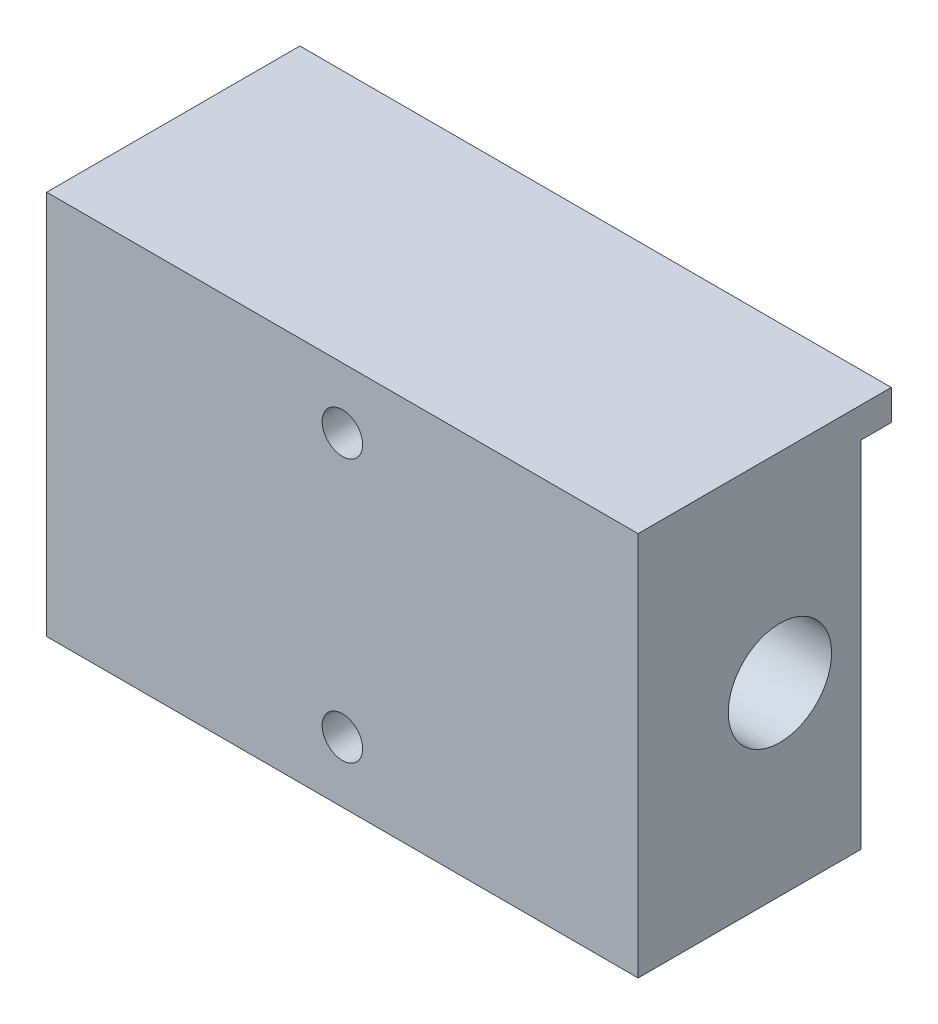
from build123d import *

# Parameters (mm, degrees)
CROQUIS1_W                                     = 58.4
CROQUIS1_H                                     = 38
SALIENTE_EXTRUIR1_DEPTH                        = 22
CROQUIS2_R                                     = 5.1
CORTAR_EXTRUIR1_DEPTH                          = 74.065450112
TALADROS_DE_ESPIGA_DE_4_0MM2_D                 = 4
TALADROS_DE_ESPIGA_DE_4_0MM2_DEPTH             = 14
TALADROS_DE_ESPIGA_DE_4_0MM2_TIP               = 1.201721238
CROQUIS6_W                                     = 58.4
CROQUIS6_H                                     = 3
SALIENTE_EXTRUIR2_DEPTH                        = 3
PERFORADOR_PARA_ROSCAR_PARA_MACHO_DE_ROS_D     = 2.5
PERFORADOR_PARA_ROSCAR_PARA_MACHO_DE_ROS_DEPTH = 14
PERFORADOR_PARA_ROSCAR_PARA_MACHO_DE_ROS_TIP   = 0.751075774


with BuildPart() as part:
    # Croquis1 → Saliente-Extruir1 (new body)
    with BuildSketch(Plane.XY):
        with Locations((29.2, 19)):
            Rectangle(CROQUIS1_W, CROQUIS1_H)
    extrude(amount=SALIENTE_EXTRUIR1_DEPTH)

    # Croquis2 → Cortar-Extruir1 (cut, through all)
    with BuildSketch(Plane(origin=(58.4, 0, 0), x_dir=(0, 0, -1), z_dir=(1, 0, 0))):
        with Locations((-8, 18.236268226)):
            Circle(CROQUIS2_R)
    extrude(amount=-CORTAR_EXTRUIR1_DEPTH, mode=Mode.SUBTRACT)

    # Taladros de espiga de Ø4.0mm2
    with Locations(Plane.XY.offset(22)):
        with Locations((29.2, 6), (29.2, 32)):
            Hole(TALADROS_DE_ESPIGA_DE_4_0MM2_D / 2, depth=TALADROS_DE_ESPIGA_DE_4_0MM2_DEPTH)
            with Locations((0, 0, -(TALADROS_DE_ESPIGA_DE_4_0MM2_DEPTH + TALADROS_DE_ESPIGA_DE_4_0MM2_TIP / 2))):  # 118° drill point
                Cone(0, TALADROS_DE_ESPIGA_DE_4_0MM2_D / 2, TALADROS_DE_ESPIGA_DE_4_0MM2_TIP, mode=Mode.SUBTRACT)

    # Croquis6 → Saliente-Extruir2 (add)
    with BuildSketch(Plane(origin=(0, 0, 0), x_dir=(-1, 0, 0), z_dir=(0, 0, -1))):
        with Locations((-29.2, 36.5)):
            Rectangle(CROQUIS6_W, CROQUIS6_H)
    extrude(amount=SALIENTE_EXTRUIR2_DEPTH)

    # Perforador para roscar para macho de roscar para M33
    with Locations(Plane.ZY):
        with Locations((16, 18.236268226), (8, 10.236268226), (8, 26.236268226)):
            Hole(PERFORADOR_PARA_ROSCAR_PARA_MACHO_DE_ROS_D / 2, depth=PERFORADOR_PARA_ROSCAR_PARA_MACHO_DE_ROS_DEPTH)
            with Locations((0, 0, -(PERFORADOR_PARA_ROSCAR_PARA_MACHO_DE_ROS_DEPTH + PERFORADOR_PARA_ROSCAR_PARA_MACHO_DE_ROS_TIP / 2))):  # 118° drill point
                Cone(0, PERFORADOR_PARA_ROSCAR_PARA_MACHO_DE_ROS_D / 2, PERFORADOR_PARA_ROSCAR_PARA_MACHO_DE_ROS_TIP, mode=Mode.SUBTRACT)


solid = part.part
